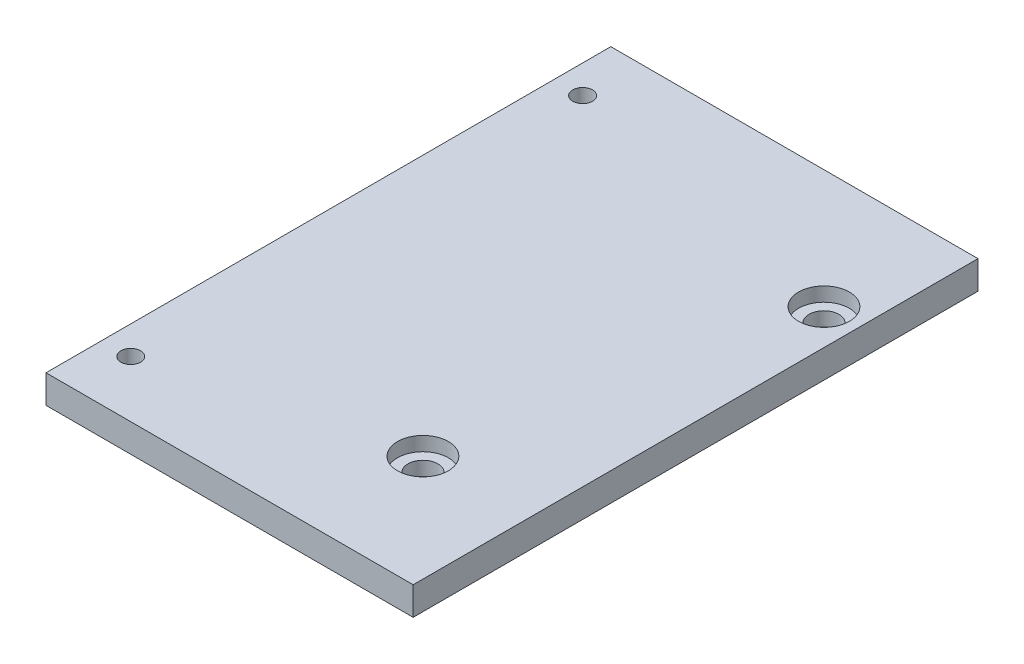
from build123d import *

# Parameters (mm, degrees)
SKETCH2_W           = 65
SKETCH2_H           = 100
SKETCH2_R           = 1.75
SKETCH2_R_2         = 2.65
BOSS_EXTRUDE1_DEPTH = 5
SKETCH3_R           = 4.5
CUT_EXTRUDE1_DEPTH  = 2.5


with BuildPart() as part:
    # Sketch2 → Boss-Extrude1 (new body)
    with BuildSketch(Plane(origin=(0, 0, 0), x_dir=(1, 0, 0), z_dir=(0, 1, 0))):
        Rectangle(SKETCH2_W, SKETCH2_H)
        with Locations((-27.5, 40)):
            Circle(SKETCH2_R, mode=Mode.SUBTRACT)
        with Locations((-27.5, -40)):
            Circle(SKETCH2_R, mode=Mode.SUBTRACT)
        with Locations((26.23, 29)):
            Circle(SKETCH2_R_2, mode=Mode.SUBTRACT)
        with Locations((13.65, -29.42)):
            Circle(SKETCH2_R_2, mode=Mode.SUBTRACT)
    extrude(amount=BOSS_EXTRUDE1_DEPTH)

    # Sketch3 → Cut-Extrude1 (cut)
    with BuildSketch(Plane(origin=(0, 5, 0), x_dir=(1, 0, 0), z_dir=(0, 1, 0))):
        with Locations((26.23, 29)):
            Circle(SKETCH3_R)
        with Locations((13.65, -29.42)):
            Circle(SKETCH3_R)
    extrude(amount=-CUT_EXTRUDE1_DEPTH, mode=Mode.SUBTRACT)


solid = part.part
